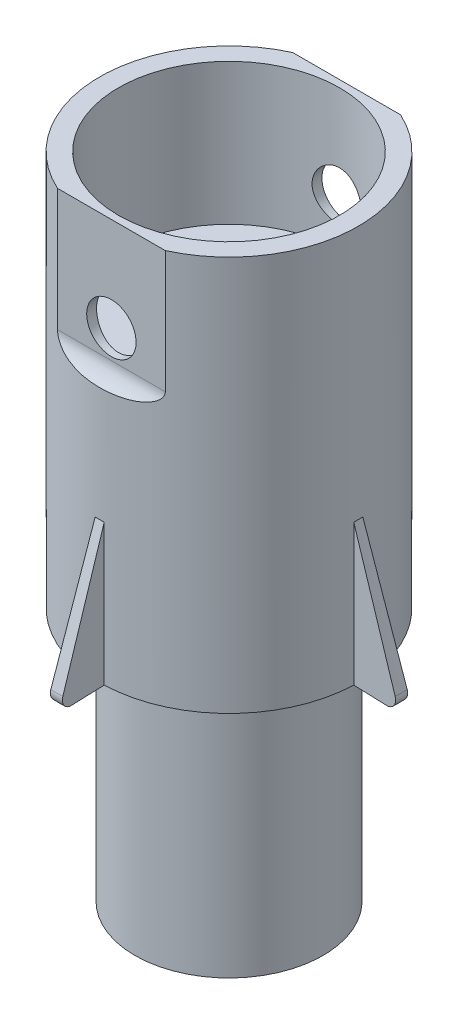
from build123d import *

# Parameters (mm, degrees)
SKETCH1_R                = 10
BOSS_EXTRUDE1_DEPTH      = 47
SHELL1_T                 = -2
SKETCH2_W                = 8
SKETCH2_H                = 17
CUT_EXTRUDE1_DEPTH       = 45
SKETCH3_R                = 2.625
CUT_EXTRUDE2_DEPTH       = 50.081564767
SKETCH4_R                = 13.75
BOSS_EXTRUDE2_DEPTH      = 22
BOSS_EXTRUDE3_START      = 20
SKETCH5_R                = 13.75
SKETCH5_R_2              = 12.75
BOSS_EXTRUDE3_DEPTH      = 20
FILLET1_R                = 0.5
SKETCH6_W                = 8
SKETCH6_H                = 30
CUT_EXTRUDE3_DEPTH       = 10
FILLET2_R                = 4
REVOLVE5_ANGLE           = 4
FILLET3_R                = 1
CIRPATTERN1_COUNT        = 4
FILLET3_OF_CIRPATTERN1_R = 1
SKETCH9_R                = 11.75
CUT_EXTRUDE4_DEPTH       = 15
CUT_EXTRUDE6_DEPTH       = 74.724950074
CUT_EXTRUDE6_DEPTH_BACK  = 74.724950074
SKETCH10_R               = 2.625
SKETCH11_W               = 15
SKETCH11_H               = 2
CUT_EXTRUDE7_DEPTH       = 15
FILLET4_R                = 2


# Some blends are built 0.0001 mm under size
with BuildPart() as part:
    # Sketch1 → Boss-Extrude1 (new body)
    with BuildSketch(Plane(origin=(0, 0, 0), x_dir=(1, 0, 0), z_dir=(0, 1, 0))):
        with Locations(Location((0, 0, 0), (0, 0, 270))):
            Circle(SKETCH1_R)
    extrude(amount=BOSS_EXTRUDE1_DEPTH)

    # Shell1
    shell1_openings = [part.faces().sort_by_distance(p)[0] for p in [
        (0, 47, 0),
    ]]
    offset(amount=SHELL1_T, openings=shell1_openings, kind=Kind.INTERSECTION)

    # Sketch2 → Cut-Extrude1 (cut)
    with BuildSketch(Plane(origin=(0, 47, 0), x_dir=(1, 0, 0), z_dir=(0, 1, 0))):
        Rectangle(SKETCH2_W, SKETCH2_H)
    extrude(amount=-CUT_EXTRUDE1_DEPTH, mode=Mode.SUBTRACT)

    # Sketch3 → Cut-Extrude2 (cut, through all)
    with BuildSketch(Plane.XY):
        with Locations(Location((0, 7, 0), (0, 0, 90))):
            Circle(SKETCH3_R)
    extrude(amount=-CUT_EXTRUDE2_DEPTH, mode=Mode.SUBTRACT)

    # Sketch4 → Boss-Extrude2 (add)
    with BuildSketch(Plane(origin=(0, 47, 0), x_dir=(1, 0, 0), z_dir=(0, 1, 0))):
        with Locations(Location((0, 0, 0), (0, 0, 270))):
            Circle(SKETCH4_R)
    extrude(amount=BOSS_EXTRUDE2_DEPTH)

    # Sketch5 → Boss-Extrude3 (add)
    with BuildSketch(Plane.XZ.offset(-47).offset(BOSS_EXTRUDE3_START)):
        with Locations(Location((0, 0, 0), (0, 0, 270))):
            Circle(SKETCH5_R)
        with Locations(Location((0, 0, 0), (0, 0, 270))):
            Circle(SKETCH5_R_2, mode=Mode.SUBTRACT)
    extrude(amount=-BOSS_EXTRUDE3_DEPTH)

    # Fillet1
    fillet1_edges = [part.edges().sort_by_distance(p)[0] for p in [
        (0, 47, -10),
        (0, 47, 12.75),
    ]]
    fillet(fillet1_edges, radius=FILLET1_R)

    # Sketch6 → Cut-Extrude3 (cut)
    with BuildSketch(Plane(origin=(0, 0, 0), x_dir=(0, 0, -1), z_dir=(1, 0, 0))):
        with Locations((0, 19.375)):
            Rectangle(SKETCH6_W, SKETCH6_H)
    extrude(amount=-CUT_EXTRUDE3_DEPTH, mode=Mode.SUBTRACT)

    # Fillet2
    fillet2_edges = [part.edges().sort_by_distance(p)[0] for p in [
        (-8.04667731, 4.375, 4),
        (-8.04667731, 4.375, -4),
    ]]
    fillet(fillet2_edges, radius=FILLET2_R - 0.0001)  # a hair under: the kernel refuses the full size

    # Sketch8 → Revolve5 (revolve, symmetric)
    with BuildSketch(Plane(origin=(0, 0, 0), x_dir=(0, 0, -1), z_dir=(1, 0, 0))) as revolve5_sk:
        Polygon((13.75, 27), (18.75, 27), (13.75, 42), align=None)
    revolve5 = revolve(axis=Axis((0, 88.2, 0), (0, -1, 0)), revolution_arc=REVOLVE5_ANGLE / 2)
    revolve5 = revolve5 + revolve(revolve5_sk.sketch, axis=Axis((0, 88.2, 0), (0, 1, 0)), revolution_arc=REVOLVE5_ANGLE / 2)

    # Fillet3
    fillet3_edges = [part.edges().sort_by_distance(p)[0] for p in [
        (0, 27, -18.75),
    ]]
    fillet(fillet3_edges, radius=FILLET3_R)

    # CirPattern1: Revolve5 ×4 about axis
    cirpattern1_axis = Axis((0, 88.2, 0), (0, -1, 0))
    for i in range(1, CIRPATTERN1_COUNT):
        add(revolve5.rotate(cirpattern1_axis, i * 360 / CIRPATTERN1_COUNT))

    # Fillet3 of CirPattern1
    fillet3_of_cirpattern1_edges = [part.edges().sort_by_distance(p)[0] for p in [
        (18.75, 27, 0),
        (0, 27, 18.75),
        (-18.75, 27, 0),
    ]]
    fillet(fillet3_of_cirpattern1_edges, radius=FILLET3_OF_CIRPATTERN1_R)

    # Sketch9 → Cut-Extrude4 (cut)
    with BuildSketch(Plane(origin=(0, 69, 0), x_dir=(1, 0, 0), z_dir=(0, 1, 0))):
        with Locations(Location((0, 0, 0), (0, 0, 270))):
            Circle(SKETCH9_R)
    extrude(amount=-CUT_EXTRUDE4_DEPTH, mode=Mode.SUBTRACT)

    # Sketch10 → Cut-Extrude6 (cut, two sides: drawn at the far end of the back side and taken through both)
    with BuildSketch(Plane.XY.offset(-CUT_EXTRUDE6_DEPTH_BACK)):
        with Locations((0, 59)):
            Circle(SKETCH10_R)
    extrude(amount=CUT_EXTRUDE6_DEPTH + CUT_EXTRUDE6_DEPTH_BACK, mode=Mode.SUBTRACT)

    # Sketch11 → Cut-Extrude7 (cut)
    with BuildSketch(Plane(origin=(0, 69, 0), x_dir=(1, 0, 0), z_dir=(0, 1, 0))):
        with Locations((0, -13.5)):
            Rectangle(SKETCH11_W, SKETCH11_H)
    cut_extrude7 = extrude(amount=-CUT_EXTRUDE7_DEPTH, mode=Mode.SUBTRACT)

    # Mirror1: Cut-Extrude7 across plane
    add(cut_extrude7.mirror(Plane.XY), mode=Mode.SUBTRACT)

    # Fillet4
    # the kernel refuses this fillet: 2 mm, written as the material it adds along each edge
    with BuildSketch(Plane(origin=(-10.728219619, 54, -12.5), x_dir=(0, 1, 0), z_dir=(1, 0, 0))) as fillet4_piece_1_section:
        with BuildLine():
            CenterArc((FILLET4_R, -FILLET4_R), FILLET4_R, 90, 90)
            Line((0, -FILLET4_R), (0, 0))
            Line((0, 0), (FILLET4_R, 0))
        make_face()
    fillet4_piece_1 = extrude(amount=21.456439237, mode=Mode.PRIVATE)
    fillet4_piece_1 = fillet4_piece_1 & Plane(origin=(0, 54.536479762, 0), x_dir=(0, 0, 1), z_dir=(0, -1, 0)) * Cylinder(13.75, 51, mode=Mode.PRIVATE)
    add(fillet4_piece_1)
    with BuildSketch(Plane(origin=(-10.728219619, 54, 12.5), x_dir=(0, 0, 1), z_dir=(1, 0, 0))) as fillet4_piece_2_section:
        with BuildLine():
            CenterArc((FILLET4_R, -FILLET4_R), FILLET4_R, 90, 90)
            Line((0, -FILLET4_R), (0, 0))
            Line((0, 0), (FILLET4_R, 0))
        make_face()
    fillet4_piece_2 = extrude(amount=21.456439237, mode=Mode.PRIVATE)
    fillet4_piece_2 = fillet4_piece_2 & Plane(origin=(0, 54.536497639, 0), x_dir=(0, 0, 1), z_dir=(0, -1, 0)) * Cylinder(13.75, 51, mode=Mode.PRIVATE)
    add(fillet4_piece_2)


solid = part.part
